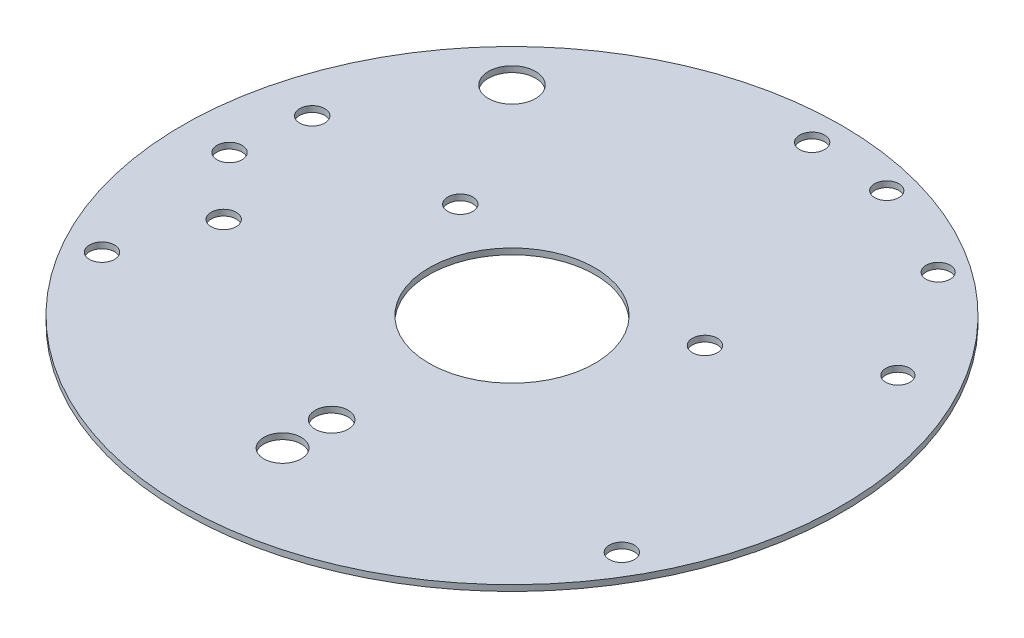
from build123d import *

# Parameters (mm, degrees)
SKETCH1_R           = 88.9
SKETCH1_R_2         = 22.352
SKETCH1_R_3         = 6.35
SKETCH1_R_4         = 5.0419
SKETCH1_R_5         = 3.3782
SKETCH1_R_6         = 3.2639
BOSS_EXTRUDE1_DEPTH = 1.6002
SKETCH2_R           = 4.445
CUT_EXTRUDE1_DEPTH  = 2.54


with BuildPart() as part:
    # Sketch1 → Boss-Extrude1 (new body)
    with BuildSketch(Plane(origin=(0, 0, 0), x_dir=(1, 0, 0), z_dir=(0, 1, 0))):
        Circle(SKETCH1_R)
        Circle(SKETCH1_R_2, mode=Mode.SUBTRACT)
        with Locations((-53.8734, 53.8734)):
            Circle(SKETCH1_R_3, mode=Mode.SUBTRACT)
        with Locations((0, -61.8998)):
            Circle(SKETCH1_R_4, mode=Mode.SUBTRACT)
        with Locations((-61.341, -16.4338)):
            Circle(SKETCH1_R_5, mode=Mode.SUBTRACT)
        with Locations((-76.2, 0)):
            Circle(SKETCH1_R_5, mode=Mode.SUBTRACT)
        with Locations((-73.6092, 19.7104)):
            Circle(SKETCH1_R_5, mode=Mode.SUBTRACT)
        with Locations((65.9892, 38.1)):
            Circle(SKETCH1_R_6, mode=Mode.SUBTRACT)
        with Locations((47.3456, 67.6148)):
            Circle(SKETCH1_R_6, mode=Mode.SUBTRACT)
        with Locations((21.3614, 79.7306)):
            Circle(SKETCH1_R_6, mode=Mode.SUBTRACT)
        with Locations((0, 80.9625)):
            Circle(SKETCH1_R_5, mode=Mode.SUBTRACT)
        with Locations((70.115581754, -40.48125)):
            Circle(SKETCH1_R_5, mode=Mode.SUBTRACT)
        with Locations((-70.115581754, -40.48125)):
            Circle(SKETCH1_R_5, mode=Mode.SUBTRACT)
        with Locations((-32.995567884, 19.05)):
            Circle(SKETCH1_R_5, mode=Mode.SUBTRACT)
        with Locations((32.995567884, 19.05)):
            Circle(SKETCH1_R_5, mode=Mode.SUBTRACT)
    extrude(amount=BOSS_EXTRUDE1_DEPTH)

    # Sketch2 → Cut-Extrude1 (cut)
    with BuildSketch(Plane(origin=(0, 1.6002, 0), x_dir=(1, 0, 0), z_dir=(0, 1, 0))):
        with Locations((0, -48.649460357)):
            Circle(SKETCH2_R)
    extrude(amount=-CUT_EXTRUDE1_DEPTH, mode=Mode.SUBTRACT)


solid = part.part
